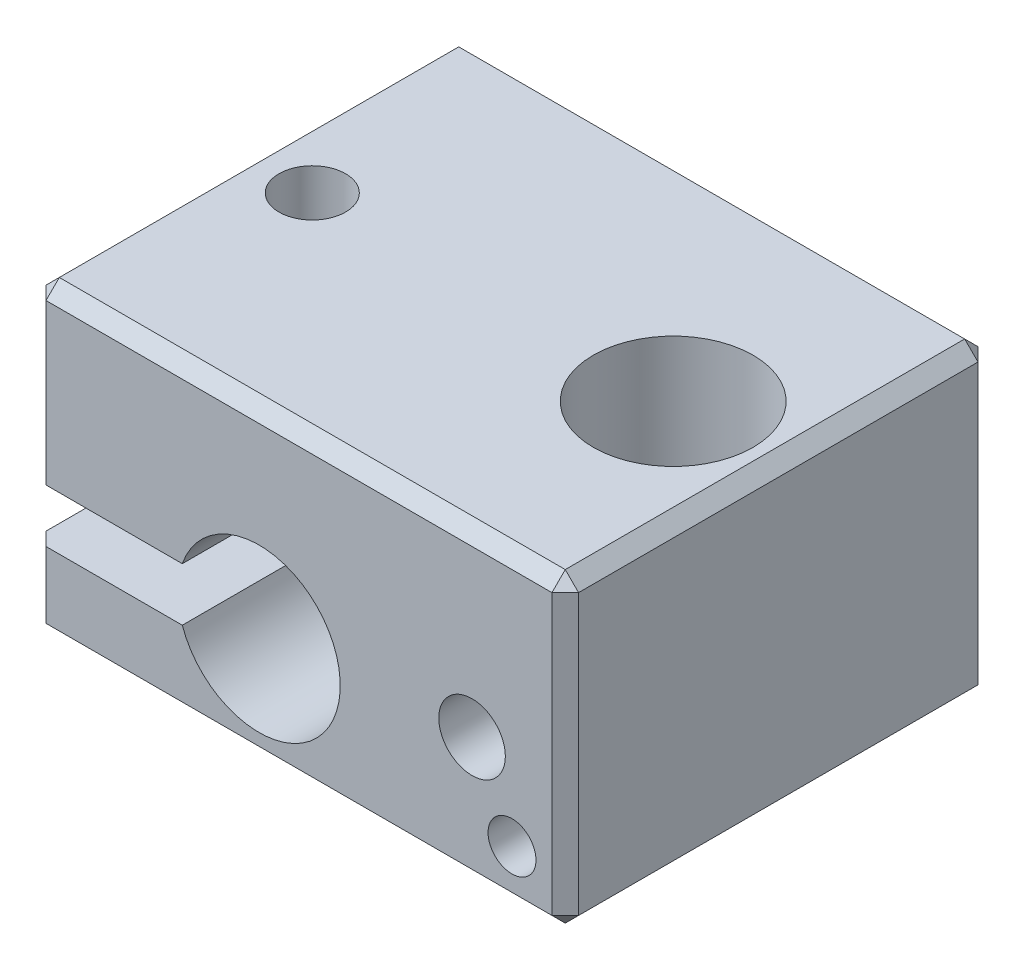
from build123d import *

# Parameters (mm, degrees)
BOSS_EXTRUDE1_DEPTH            = 8
CHAMFER1_SIZE                  = 0.5
M3X0_5_TAPPED_HOLE1_D          = 2.5
M3X0_5_TAPPED_HOLE1_DEPTH      = 3.5
M3X0_5_TAPPED_HOLE1_TIP        = 0.751075774
F_1_8_1_8_DIAMETER_HOLE1_D     = 1.8
F_1_8_1_8_DIAMETER_HOLE1_DEPTH = 2
F_1_8_1_8_DIAMETER_HOLE1_TIP   = 0.540774557
F_1_6_1_6_DIAMETER_HOLE1_D     = 1.6
F_1_6_1_6_DIAMETER_HOLE1_DEPTH = 4.5
F_1_6_1_6_DIAMETER_HOLE1_TIP   = 0.480688495
M3X0_5_TAPPED_HOLE2_D          = 2.5
M6X1_0_TAPPED_HOLE1_D          = 6


with BuildPart() as part:
    # Sketch1 → Boss-Extrude1 (new, symmetric)
    with BuildSketch(Plane.XY):
        with BuildLine():
            Line((-10, -0.75), (-4.381405907, -0.75))
            ThreePointArc((-4.381405907, -0.75), (1.55, -1.75), (-4.381405907, -2.75))
            Line((-4.381405907, -2.75), (-10, -2.75))
            Line((-10, -2.75), (-10, -5.75))
            Line((-10, -5.75), (10, -5.75))
            Line((10, -5.75), (10, 5.75))
            Line((10, 5.75), (-10, 5.75))
            Line((-10, 5.75), (-10, -0.75))
        make_face()
    extrude(amount=BOSS_EXTRUDE1_DEPTH, both=True)

    # Chamfer1
    chamfer1_edges = [part.edges().sort_by_distance(p)[0] for p in [
        (0, -5.75, -8),
        (-10, -4.25, -8),
        (-10, -5.75, 0),
        (-10, 2.5, -8),
        (-10, -4.25, 8),
        (0, -5.75, 8),
        (-10, 2.5, 8),
        (10, -5.75, 0),
        (10, 0, -8),
        (10, 0, 8),
        (10, 5.75, 0),
        (0, 5.75, -8),
        (0, 5.75, 8),
        (-10, 5.75, 0),
    ]]
    chamfer(chamfer1_edges, length=CHAMFER1_SIZE)

    # M3x0.5 Tapped Hole1
    with Locations(Plane.XY.offset(8)):
        with Locations((6.5, -0.95)):
            Hole(M3X0_5_TAPPED_HOLE1_D / 2, depth=M3X0_5_TAPPED_HOLE1_DEPTH)
            with Locations((0, 0, -(M3X0_5_TAPPED_HOLE1_DEPTH + M3X0_5_TAPPED_HOLE1_TIP / 2))):  # 118° drill point
                Cone(0, M3X0_5_TAPPED_HOLE1_D / 2, M3X0_5_TAPPED_HOLE1_TIP, mode=Mode.SUBTRACT)

    # Ø1.8 (1.8) Diameter Hole1
    with Locations(Plane.XY.offset(8)):
        with Locations((8, -3.75)):
            Hole(F_1_8_1_8_DIAMETER_HOLE1_D / 2, depth=F_1_8_1_8_DIAMETER_HOLE1_DEPTH)
            with Locations((0, 0, -(F_1_8_1_8_DIAMETER_HOLE1_DEPTH + F_1_8_1_8_DIAMETER_HOLE1_TIP / 2))):  # 118° drill point
                Cone(0, F_1_8_1_8_DIAMETER_HOLE1_D / 2, F_1_8_1_8_DIAMETER_HOLE1_TIP, mode=Mode.SUBTRACT)

    # Ø1.6 (1.6) Diameter Hole1
    with Locations(Plane.XY.offset(8)):
        with Locations((8, -3.75)):
            Hole(F_1_6_1_6_DIAMETER_HOLE1_D / 2, depth=F_1_6_1_6_DIAMETER_HOLE1_DEPTH)
            with Locations((0, 0, -(F_1_6_1_6_DIAMETER_HOLE1_DEPTH + F_1_6_1_6_DIAMETER_HOLE1_TIP / 2))):  # 118° drill point
                Cone(0, F_1_6_1_6_DIAMETER_HOLE1_D / 2, F_1_6_1_6_DIAMETER_HOLE1_TIP, mode=Mode.SUBTRACT)

    # M3x0.5 Tapped Hole2 (through all)
    with Locations(Plane(origin=(0, 5.75, 0), x_dir=(1, 0, 0), z_dir=(0, 1, 0))):
        with Locations((-7.5, 0)):
            Hole(M3X0_5_TAPPED_HOLE2_D / 2)

    # M6x1.0 Tapped Hole1 (through all)
    with Locations(Plane(origin=(0, 5.75, 0), x_dir=(1, 0, 0), z_dir=(0, 1, 0))):
        with Locations((6.053799896, 0)):
            Hole(M6X1_0_TAPPED_HOLE1_D / 2)


solid = part.part
